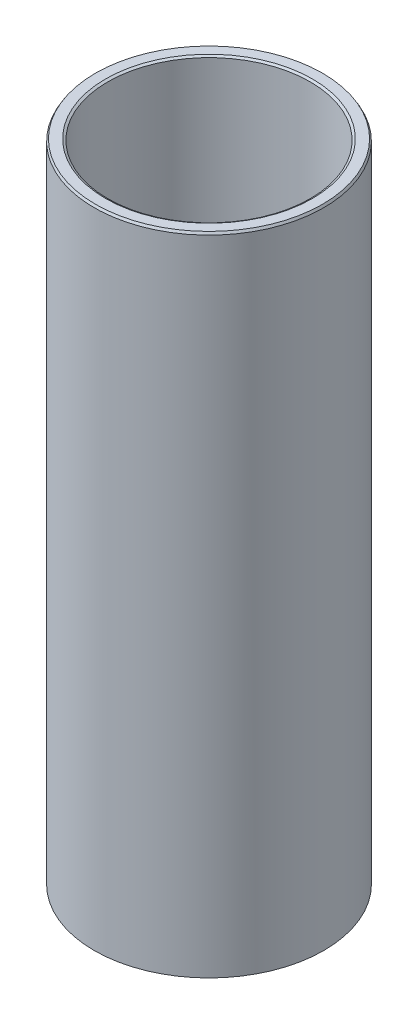
from build123d import *
from OCP.BRepFilletAPI import BRepFilletAPI_MakeChamfer

# Parameters (mm, degrees)
SKETCH1_R           = 37.5
BOSS_EXTRUDE1_DEPTH = 211.1822574
SKETCH2_R           = 33.043392856
CUT_EXTRUDE1_DEPTH  = 218.739398916
CHAMFER1_SIZE       = 0.745551426
CHAMFER1_SIZE2      = 0.430444317


with BuildPart() as part:
    # Sketch1 → Boss-Extrude1 (new body)
    with BuildSketch(Plane(origin=(0, 0, 0), x_dir=(1, 0, 0), z_dir=(0, 1, 0))):
        Circle(SKETCH1_R)
    extrude(amount=BOSS_EXTRUDE1_DEPTH)

    # Sketch2 → Cut-Extrude1 (cut, through all)
    with BuildSketch(Plane(origin=(0, 0, 0), x_dir=(1, 0, 0), z_dir=(0, 1, 0))):
        Circle(SKETCH2_R)
    extrude(amount=CUT_EXTRUDE1_DEPTH, mode=Mode.SUBTRACT)

    # Chamfer1: one chamfer whose edges measure the first distance from different faces: ONE call of the kernel's chamfer builder (chamfer() names one face for all edges)
    chamfer1_edges_1 = [part.edges().sort_by_distance(p)[0] for p in [
        (-33.043392856, 211.1822574, 0),
    ]]
    chamfer1_side_1 = [part.faces().sort_by_distance(p)[0] for p in [
        (-36.439339828, 211.1822574, 0),
    ]]
    chamfer1_edges_2 = [part.edges().sort_by_distance(p)[0] for p in [
        (-33.043392856, 0, 0),
    ]]
    chamfer1_side_2 = [part.faces().sort_by_distance(p)[0] for p in [
        (-33.043392856, 105.5911287, 0),
    ]]
    chamfer1_edges_3 = [part.edges().sort_by_distance(p)[0] for p in [
        (-37.5, 0, 0),
    ]]
    chamfer1_side_3 = [part.faces().sort_by_distance(p)[0] for p in [
        (-36.439339828, 0, 0),
    ]]
    chamfer1_edges_4 = [part.edges().sort_by_distance(p)[0] for p in [
        (-37.5, 211.1822574, 0),
    ]]
    chamfer1_side_4 = [part.faces().sort_by_distance(p)[0] for p in [
        (-37.5, 105.5911287, 0),
    ]]
    chamfer1 = BRepFilletAPI_MakeChamfer(part.part.solid().wrapped)
    for e in chamfer1_edges_1:
        chamfer1.Add(CHAMFER1_SIZE, CHAMFER1_SIZE2, e.wrapped, chamfer1_side_1[0].wrapped)  # the first distance lies on this face
    for e in chamfer1_edges_2:
        chamfer1.Add(CHAMFER1_SIZE, CHAMFER1_SIZE2, e.wrapped, chamfer1_side_2[0].wrapped)  # the first distance lies on this face
    for e in chamfer1_edges_3:
        chamfer1.Add(CHAMFER1_SIZE, CHAMFER1_SIZE2, e.wrapped, chamfer1_side_3[0].wrapped)  # the first distance lies on this face
    for e in chamfer1_edges_4:
        chamfer1.Add(CHAMFER1_SIZE, CHAMFER1_SIZE2, e.wrapped, chamfer1_side_4[0].wrapped)  # the first distance lies on this face
    add(Compound.cast(chamfer1.Shape()), mode=Mode.REPLACE)


solid = part.part
